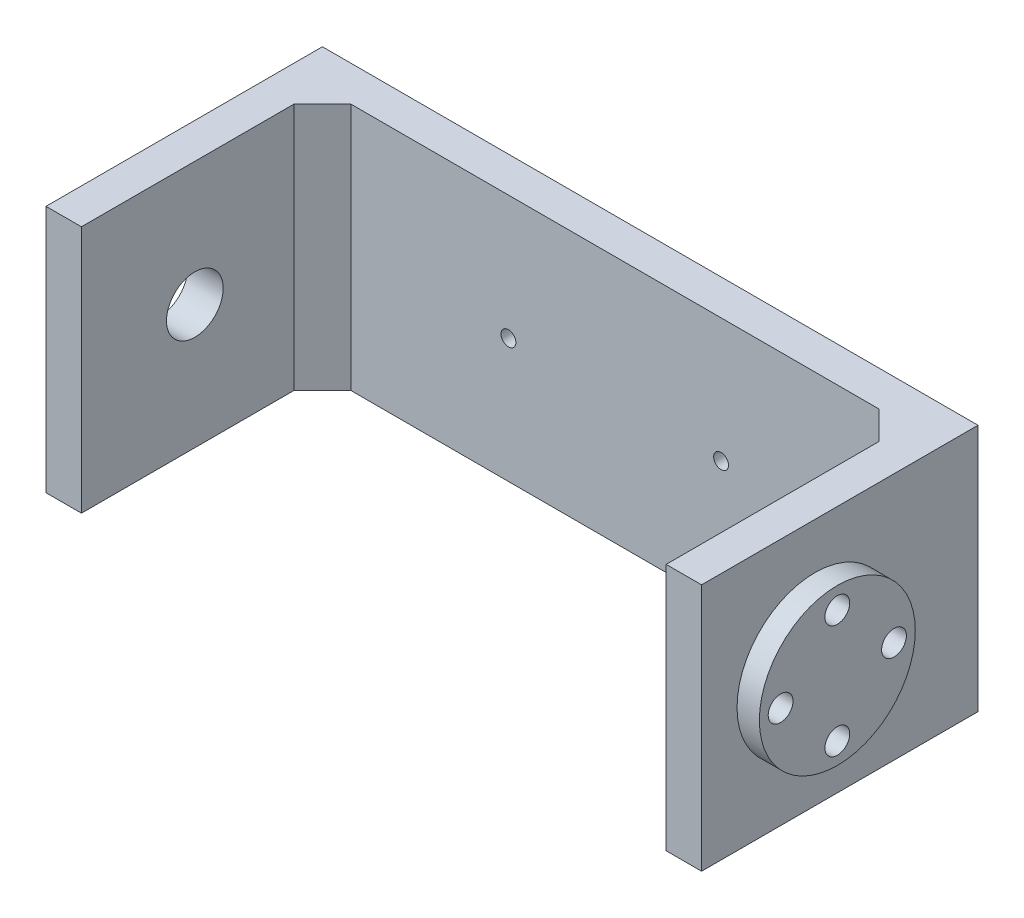
from build123d import *

# Parameters (mm, degrees)
BOSS_EXTRUDE2_DEPTH = 35
SKETCH3_R           = 1.75
BOSS_EXTRUDE5_DEPTH = 3.15
CUT_EXTRUDE2_REACH  = 108.312
SKETCH5_R           = 1.75
SKETCH6_R           = 2.5
CUT_EXTRUDE3_DEPTH  = 2.15
CUT_EXTRUDE4_REACH  = 111.064
SKETCH7_R           = 4
CHAMFER1_SIZE       = 4
SKETCH8_R           = 1.05
CUT_EXTRUDE5_DEPTH  = 2
CUT_EXTRUDE6_REACH  = 111.064
SKETCH9_R           = 1.05


with BuildPart() as part:
    # Sketch1 → Boss-Extrude2 (new body)
    with BuildSketch(Plane(origin=(0, 0, 0), x_dir=(1, 0, 0), z_dir=(0, 1, 0))):
        Polygon((0, 0), (0, 39), (92.5, 39), (92.5, 0), (87.5, 0), (87.5, 34), (5, 34), (5, 0), align=None)
    extrude(amount=BOSS_EXTRUDE2_DEPTH)

    # Sketch3 → Boss-Extrude5 (add)
    with BuildSketch(Plane(origin=(92.5, 0, 0), x_dir=(0, 0, -1), z_dir=(1, 0, 0))):
        with BuildLine():
            ThreePointArc((27, 17.5), (8.221825407, 25.278174593), (16, 6.5))
            ThreePointArc((16, 6.5), (23.778174593, 9.721825407), (27, 17.5))
        make_face()
        with BuildLine():
            ThreePointArc((17.75, 9.5), (17.237436867, 8.262563133), (16, 7.75))
            ThreePointArc((16, 7.75), (14.762563133, 10.737436867), (17.75, 9.5))
        make_face(mode=Mode.SUBTRACT)
        with Locations((24, 17.5)):
            Circle(SKETCH3_R, mode=Mode.SUBTRACT)
        with Locations((8, 17.5)):
            Circle(SKETCH3_R, mode=Mode.SUBTRACT)
        with Locations((16, 25.5)):
            Circle(SKETCH3_R, mode=Mode.SUBTRACT)
    extrude(amount=BOSS_EXTRUDE5_DEPTH)

    # Sketch5 → Cut-Extrude2 (cut, up to next)
    with BuildSketch(Plane(origin=(92.5, 0, 0), x_dir=(0, 0, -1), z_dir=(1, 0, 0)), mode=Mode.PRIVATE) as cut_extrude2_sk1:
        with Locations((16, 9.5)):
            Circle(SKETCH5_R)
    cut_extrude2_tool1 = extrude(cut_extrude2_sk1.sketch, amount=-CUT_EXTRUDE2_REACH, mode=Mode.PRIVATE) & part.part
    # Sketch5 → Cut-Extrude2 (cut, up to next)
    with BuildSketch(Plane(origin=(92.5, 0, 0), x_dir=(0, 0, -1), z_dir=(1, 0, 0)), mode=Mode.PRIVATE) as cut_extrude2_sk2:
        with Locations((24, 17.5)):
            Circle(SKETCH5_R)
    cut_extrude2_tool2 = extrude(cut_extrude2_sk2.sketch, amount=-CUT_EXTRUDE2_REACH, mode=Mode.PRIVATE) & part.part
    # Sketch5 → Cut-Extrude2 (cut, up to next)
    with BuildSketch(Plane(origin=(92.5, 0, 0), x_dir=(0, 0, -1), z_dir=(1, 0, 0)), mode=Mode.PRIVATE) as cut_extrude2_sk3:
        with Locations((16, 25.5)):
            Circle(SKETCH5_R)
    cut_extrude2_tool3 = extrude(cut_extrude2_sk3.sketch, amount=-CUT_EXTRUDE2_REACH, mode=Mode.PRIVATE) & part.part
    # Sketch5 → Cut-Extrude2 (cut, up to next)
    with BuildSketch(Plane(origin=(92.5, 0, 0), x_dir=(0, 0, -1), z_dir=(1, 0, 0)), mode=Mode.PRIVATE) as cut_extrude2_sk4:
        with Locations((8, 17.5)):
            Circle(SKETCH5_R)
    cut_extrude2_tool4 = extrude(cut_extrude2_sk4.sketch, amount=-CUT_EXTRUDE2_REACH, mode=Mode.PRIVATE) & part.part
    add(cut_extrude2_tool1.solids().sort_by_distance((92.5, 9.5, -16))[0], mode=Mode.SUBTRACT)
    add(cut_extrude2_tool2.solids().sort_by_distance((92.5, 17.5, -24))[0], mode=Mode.SUBTRACT)
    add(cut_extrude2_tool3.solids().sort_by_distance((92.5, 25.5, -16))[0], mode=Mode.SUBTRACT)
    add(cut_extrude2_tool4.solids().sort_by_distance((92.5, 17.5, -8))[0], mode=Mode.SUBTRACT)

    # Sketch6 → Cut-Extrude3 (cut)
    with BuildSketch(Plane.ZY.offset(-87.5)):
        with Locations((-16, 9.5)):
            Circle(SKETCH6_R)
        with Locations((-24, 17.5)):
            Circle(SKETCH6_R)
        with Locations((-16, 25.5)):
            Circle(SKETCH6_R)
        with Locations((-8, 17.5)):
            Circle(SKETCH6_R)
    extrude(amount=-CUT_EXTRUDE3_DEPTH, mode=Mode.SUBTRACT)

    # Sketch7 → Cut-Extrude4 (cut, up to next)
    with BuildSketch(Plane.ZY, mode=Mode.PRIVATE) as cut_extrude4_sk1:
        with Locations((-16, 17.5)):
            Circle(SKETCH7_R)
    cut_extrude4_tool1 = extrude(cut_extrude4_sk1.sketch, amount=-CUT_EXTRUDE4_REACH, mode=Mode.PRIVATE) & part.part
    add(cut_extrude4_tool1.solids().sort_by_distance((0, 17.5, -16))[0], mode=Mode.SUBTRACT)

    # Chamfer1
    chamfer1_edges = [part.edges().sort_by_distance(p)[0] for p in [
        (5, 17.5, -34),
        (87.5, 17.5, -34),
    ]]
    chamfer(chamfer1_edges, length=CHAMFER1_SIZE)

    # Sketch8 → Cut-Extrude5 (cut)
    # profile 1 of 2: a face of its own
    with BuildSketch(Plane(origin=(0, 0, -39), x_dir=(-1, 0, 0), z_dir=(0, 0, -1))):
        Polygon((-59.25, 16.345299462), (-59.25, 17.5), (-59.25, 18.654700538), (-61.25, 19.809401077), (-63.25, 18.654700538), (-63.25, 16.345299462), (-61.25, 15.190598923), align=None)
        with Locations((-61.25, 17.5)):
            Circle(SKETCH8_R, mode=Mode.SUBTRACT)
    # profile 2 of 2: a face of its own
    with BuildSketch(Plane(origin=(0, 0, -39), x_dir=(-1, 0, 0), z_dir=(0, 0, -1))):
        Polygon((-31.25, 15.190598923), (-29.25, 16.345299462), (-29.25, 18.654700538), (-31.25, 19.809401077), (-33.25, 18.654700538), (-33.25, 16.345299462), align=None)
        with Locations((-31.25, 17.5)):
            Circle(SKETCH8_R, mode=Mode.SUBTRACT)
    extrude(amount=-CUT_EXTRUDE5_DEPTH, mode=Mode.SUBTRACT)

    # Sketch9 → Cut-Extrude6 (cut, up to next)
    with BuildSketch(Plane(origin=(0, 0, -39), x_dir=(-1, 0, 0), z_dir=(0, 0, -1)), mode=Mode.PRIVATE) as cut_extrude6_sk1:
        with Locations((-61.25, 17.5)):
            Circle(SKETCH9_R)
    cut_extrude6_tool1 = extrude(cut_extrude6_sk1.sketch, amount=-CUT_EXTRUDE6_REACH, mode=Mode.PRIVATE) & part.part
    # Sketch9 → Cut-Extrude6 (cut, up to next)
    with BuildSketch(Plane(origin=(0, 0, -39), x_dir=(-1, 0, 0), z_dir=(0, 0, -1)), mode=Mode.PRIVATE) as cut_extrude6_sk2:
        with Locations((-31.25, 17.5)):
            Circle(SKETCH9_R)
    cut_extrude6_tool2 = extrude(cut_extrude6_sk2.sketch, amount=-CUT_EXTRUDE6_REACH, mode=Mode.PRIVATE) & part.part
    add(cut_extrude6_tool1.solids().sort_by_distance((61.25, 17.5, -39))[0], mode=Mode.SUBTRACT)
    add(cut_extrude6_tool2.solids().sort_by_distance((31.25, 17.5, -39))[0], mode=Mode.SUBTRACT)


solid = part.part
